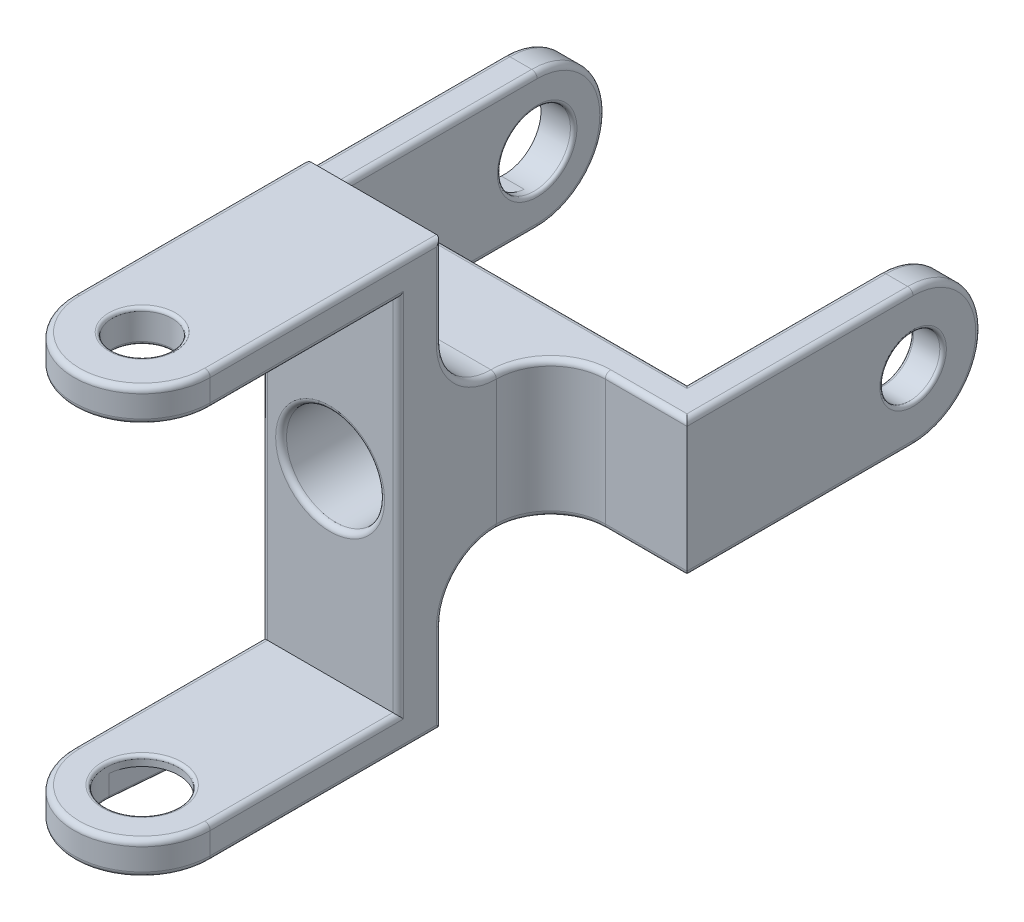
from build123d import *

# Parameters (mm, degrees)
SKETCH_1_W           = 12.5
SKETCH_1_H           = 39
EXTRUDE_1_DEPTH      = 4
SKETCH_2_W           = 12.5
SKETCH_2_H           = 3
EXTRUDE_2_DEPTH      = 17.25
SKETCH_5_R           = 6.25
EXTRUDE_3_DEPTH      = 3
EXTRUDE_START        = -3
SKETCH_6_R           = 6.25
EXTRUDE_4_DEPTH      = 3
SKETCH_7_W           = 12.5
SKETCH_7_H           = 12.5
EXTRUDE_5_DEPTH      = 10
SKETCH_8_W           = 37.5
SKETCH_8_H           = 12.5
EXTRUDE_6_DEPTH      = 3
SKETCH_9_W           = 3
SKETCH_9_H           = 12.5
EXTRUDE_7_DEPTH      = 17.75
SKETCH_10_R          = 6.25
EXTRUDE_8_DEPTH      = 3
SKETCH_11_R          = 6.25
EXTRUDE_9_DEPTH      = 3
FILLET_1_R           = 5
CUT_EXTRUDE_4_DEPTH  = 2.1
CUT_EXTRUDE_5_REACH  = 56.794
SKETCH_16_R          = 3.35
CUT_EXTRUDE_6_REACH  = 58.174
SKETCH_17_R          = 2.75
FILLET_2_R           = 0.5
FILLET_3_R           = 0.5
CUT_EXTRUDE_7_DEPTH  = 2.1
CUT_EXTRUDE_8_REACH  = 57.517
SKETCH_19_R          = 3.35
CUT_EXTRUDE_9_REACH  = 58.935
SKETCH_20_R          = 2.75
FILLET_4_R           = 0.3
SKETCH_21_R          = 4.5
CUT_EXTRUDE_10_DEPTH = 50.120387908
FILLET_5_R           = 0.5
FILLET_6_R           = 0.3


with BuildPart() as part:
    # 草图1 → 凸台-拉伸1 (new body)
    with BuildSketch(Plane.XY):
        Rectangle(SKETCH_1_W, SKETCH_1_H)
    extrude(amount=EXTRUDE_1_DEPTH)

    # 草图2 → 凸台-拉伸2 (add)
    with BuildSketch(Plane.XY.offset(4)):
        with Locations((0, 18)):
            Rectangle(SKETCH_2_W, SKETCH_2_H)
        with Locations((0, -18)):
            Rectangle(SKETCH_2_W, SKETCH_2_H)
    extrude(amount=EXTRUDE_2_DEPTH)

    # 草图5 → 凸台-拉伸3 (add)
    with BuildSketch(Plane(origin=(0, 19.5, 0), x_dir=(1, 0, 0), z_dir=(0, 1, 0))):
        with Locations((0, -21.25)):
            Circle(SKETCH_5_R)
    extrude(amount=-EXTRUDE_3_DEPTH)

    # 草图6 → 凸台-拉伸4 (add)
    with BuildSketch(Plane.XZ.offset(19.5).offset(EXTRUDE_START)):
        with Locations((0, 21.25)):
            Circle(SKETCH_6_R)
    extrude(amount=EXTRUDE_4_DEPTH)

    # 草图7 → 凸台-拉伸5 (add)
    with BuildSketch(Plane(origin=(0, 0, 0), x_dir=(-1, 0, 0), z_dir=(0, 0, -1))):
        Rectangle(SKETCH_7_W, SKETCH_7_H)
    extrude(amount=EXTRUDE_5_DEPTH)

    # 草图8 → 凸台-拉伸6 (add)
    with BuildSketch(Plane(origin=(0, 0, -10), x_dir=(-1, 0, 0), z_dir=(0, 0, -1))):
        Rectangle(SKETCH_8_W, SKETCH_8_H)
    extrude(amount=EXTRUDE_6_DEPTH)

    # 草图9 → 凸台-拉伸7 (add)
    with BuildSketch(Plane(origin=(0, 0, -13), x_dir=(-1, 0, 0), z_dir=(0, 0, -1))):
        with Locations((-17.25, 0)):
            Rectangle(SKETCH_9_W, SKETCH_9_H)
        with Locations((17.25, 0)):
            Rectangle(SKETCH_9_W, SKETCH_9_H)
    extrude(amount=EXTRUDE_7_DEPTH)

    # 草图10 → 凸台-拉伸8 (add)
    with BuildSketch(Plane(origin=(18.75, 0, 0), x_dir=(0, 0, -1), z_dir=(1, 0, 0))):
        with Locations((30.75, 0)):
            Circle(SKETCH_10_R)
    extrude(amount=-EXTRUDE_8_DEPTH)

    # 草图11 → 凸台-拉伸9 (add)
    with BuildSketch(Plane.ZY.offset(18.75).offset(EXTRUDE_START)):
        with Locations((-30.75, 0)):
            Circle(SKETCH_11_R)
    extrude(amount=EXTRUDE_9_DEPTH)

    # 圆角1
    fillet_1_edges = [part.edges().sort_by_distance(p)[0] for p in [
        (0, -6.25, 0),
        (6.25, 0, -10),
        (0, 6.25, 0),
        (-6.25, 0, -10),
    ]]
    fillet(fillet_1_edges, radius=FILLET_1_R - 0.0001)  # a hair under: the kernel refuses the full size

    # 草图15 → 切除-拉伸4 (cut)
    with BuildSketch(Plane.ZY.offset(18.75)):
        with BuildLine():
            Line((-30.456875, 3.33715114), (-14.579375, 1.942520813))
            ThreePointArc((-14.579375, 1.942520813), (-12.8, 0), (-14.579375, -1.942520813))
            Line((-14.579375, -1.942520813), (-30.456875, -3.33715114))
            ThreePointArc((-30.456875, -3.33715114), (-34.1, 0), (-30.456875, 3.33715114))
        make_face()
    extrude(amount=-CUT_EXTRUDE_4_DEPTH, mode=Mode.SUBTRACT)

    # 草图16 → 切除-拉伸5 (cut, up to next)
    with BuildSketch(Plane.ZY.offset(16.65), mode=Mode.PRIVATE) as cut_extrude_5_sk1:
        with Locations((-30.75, 0)):
            Circle(SKETCH_16_R)
    cut_extrude_5_tool1 = extrude(cut_extrude_5_sk1.sketch, amount=-CUT_EXTRUDE_5_REACH, mode=Mode.PRIVATE) & part.part
    add(cut_extrude_5_tool1.solids().sort_by_distance((-16.65, 0, -30.75))[0], mode=Mode.SUBTRACT)

    # 草图17 → 切除-拉伸6 (cut, up to next)
    with BuildSketch(Plane(origin=(18.75, 0, 0), x_dir=(0, 0, -1), z_dir=(1, 0, 0)), mode=Mode.PRIVATE) as cut_extrude_6_sk1:
        with Locations((30.75, 0)):
            Circle(SKETCH_17_R)
    cut_extrude_6_tool1 = extrude(cut_extrude_6_sk1.sketch, amount=-CUT_EXTRUDE_6_REACH, mode=Mode.PRIVATE) & part.part
    add(cut_extrude_6_tool1.solids().sort_by_distance((18.75, 0, -30.75))[0], mode=Mode.SUBTRACT)

    # 圆角2
    fillet_2_edges = [part.edges().sort_by_distance(p)[0] for p in [
        (18.75, 0, -37),
        (-18.75, 0, -37),
        (-14.99995, -6.25, -10),
        (-6.25, -15.37495, 0),
        (14.99995, 6.25, -10),
        (6.25, 15.37495, 0),
        (-6.25, -7.714436805, -1.464436805),
        (6.25, -7.714436805, -1.464436805),
        (7.714436805, -6.25, -8.535563195),
        (7.714436805, 6.25, -8.535563195),
        (6.25, 7.714436805, -1.464436805),
        (-6.25, 7.714436805, -1.464436805),
        (-7.714436805, 6.25, -8.535563195),
        (-7.714436805, -6.25, -8.535563195),
        (-6.25, 0, 4),
        (-6.25, 16.5, 12.625),
        (6.25, 16.5, 12.625),
        (6.25, 0, 4),
        (-6.25, -16.5, 12.625),
        (6.25, -16.5, 12.625),
        (0, 16.5, 27.5),
        (0, 19.5, 27.5),
        (0, -16.5, 27.5),
        (0, -19.5, 27.5),
        (-6.25, 15.37495, 0),
        (6.25, -15.37495, 0),
        (-18.75, -6.25, -20.375),
        (-14.99995, 6.25, -10),
        (-18.75, 6.25, -20.375),
        (18.75, 6.25, -20.375),
        (14.99995, -6.25, -10),
        (18.75, -6.25, -20.375),
        (6.25, -19.5, 10.625),
        (-6.25, -19.5, 10.625),
        (-6.25, 19.5, 10.625),
        (6.25, 19.5, 10.625),
    ]]
    fillet(fillet_2_edges, radius=FILLET_2_R)

    # 圆角3
    fillet_3_edges = [part.edges().sort_by_distance(p)[0] for p in [
        (15.75, 0, -37),
        (-15.75, 0, -37),
        (0, -6.25, -13),
        (15.75, -6.25, -21.875),
        (15.75, 6.25, -21.875),
        (0, 6.25, -13),
        (-15.75, 6.25, -21.875),
        (-15.75, -6.25, -21.875),
    ]]
    fillet(fillet_3_edges, radius=FILLET_3_R)

    # 草图18 → 切除-拉伸7 (cut)
    with BuildSketch(Plane.XZ.offset(19.5)):
        with BuildLine():
            Line((-3.33715114, 20.956875), (-1.942520813, 5.079375))
            ThreePointArc((-1.942520813, 5.079375), (0, 3.3), (1.942520813, 5.079375))
            Line((1.942520813, 5.079375), (3.33715114, 20.956875))
            ThreePointArc((3.33715114, 20.956875), (0, 24.6), (-3.33715114, 20.956875))
        make_face()
    extrude(amount=-CUT_EXTRUDE_7_DEPTH, mode=Mode.SUBTRACT)

    # 草图19 → 切除-拉伸8 (cut, up to next)
    with BuildSketch(Plane.XZ.offset(17.4), mode=Mode.PRIVATE) as cut_extrude_8_sk1:
        with Locations(Location((0, 21.25, 0), (0, 0, 354.980199868))):
            Circle(SKETCH_19_R)
    cut_extrude_8_tool1 = extrude(cut_extrude_8_sk1.sketch, amount=-CUT_EXTRUDE_8_REACH, mode=Mode.PRIVATE) & part.part
    add(cut_extrude_8_tool1.solids().sort_by_distance((0, -17.4, 21.25))[0], mode=Mode.SUBTRACT)

    # 草图20 → 切除-拉伸9 (cut, up to next)
    with BuildSketch(Plane(origin=(0, 19.5, 0), x_dir=(1, 0, 0), z_dir=(0, 1, 0)), mode=Mode.PRIVATE) as cut_extrude_9_sk1:
        with Locations(Location((0, -21.25, 0), (0, 0, 270))):
            Circle(SKETCH_20_R)
    cut_extrude_9_tool1 = extrude(cut_extrude_9_sk1.sketch, amount=-CUT_EXTRUDE_9_REACH, mode=Mode.PRIVATE) & part.part
    add(cut_extrude_9_tool1.solids().sort_by_distance((0, 19.5, 21.25))[0], mode=Mode.SUBTRACT)

    # 圆角4
    fillet_4_edges = [part.edges().sort_by_distance(p)[0] for p in [
        (0, -19.5, 24.6),
        (-2.639835977, -19.5, 13.018125),
        (0, -19.5, 3.3),
        (2.639835977, -19.5, 13.018125),
        (-3.33715114, -16.5, 21.543125),
        (0, 19.5, 18.5),
        (0, 16.5, 18.5),
    ]]
    fillet(fillet_4_edges, radius=FILLET_4_R)

    # 草图21 → 切除-拉伸10 (cut, through all)
    with BuildSketch(Plane.XY.offset(4)):
        Circle(SKETCH_21_R)
    extrude(amount=-CUT_EXTRUDE_10_DEPTH, mode=Mode.SUBTRACT)

    # 圆角5
    fillet_5_edges = [part.edges().sort_by_distance(p)[0] for p in [
        (-4.5, 0, -13),
        (-4.5, 0, 4),
    ]]
    fillet(fillet_5_edges, radius=FILLET_5_R)

    # 圆角6
    fillet_6_edges = [part.edges().sort_by_distance(p)[0] for p in [
        (-15.75, 0, -34.1),
        (18.75, 0, -28),
        (15.75, 0, -28),
    ]]
    fillet(fillet_6_edges, radius=FILLET_6_R)


solid = part.part
